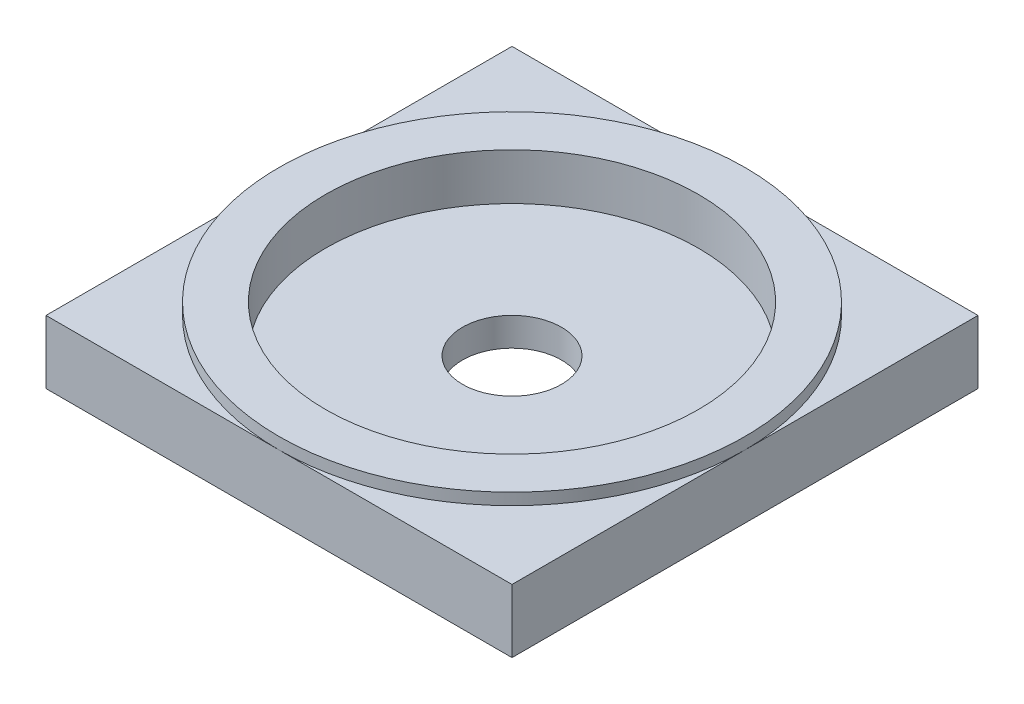
from build123d import *

# Parameters (mm, degrees)
SKETCH2_W           = 63.5
SKETCH2_H           = 63.5
BOSS_EXTRUDE1_DEPTH = 8.636
SKETCH3_R           = 31.75
BOSS_EXTRUDE2_DEPTH = 1.5875
SKETCH4_R           = 25.4
CUT_EXTRUDE1_DEPTH  = 6.35
SKETCH5_R           = 6.74624
CUT_EXTRUDE3_DEPTH  = 46.348070521


with BuildPart() as part:
    # Sketch2 → Boss-Extrude1 (new body)
    with BuildSketch(Plane(origin=(0, 0, 0), x_dir=(1, 0, 0), z_dir=(0, 1, 0))):
        Rectangle(SKETCH2_W, SKETCH2_H)
    extrude(amount=-BOSS_EXTRUDE1_DEPTH)

    # Sketch3 → Boss-Extrude2 (add)
    with BuildSketch(Plane(origin=(0, 0, 0), x_dir=(1, 0, 0), z_dir=(0, 1, 0))):
        Circle(SKETCH3_R)
    extrude(amount=BOSS_EXTRUDE2_DEPTH)

    # Sketch4 → Cut-Extrude1 (cut)
    with BuildSketch(Plane(origin=(0, 1.5875, 0), x_dir=(1, 0, 0), z_dir=(0, 1, 0))):
        Circle(SKETCH4_R)
    extrude(amount=-CUT_EXTRUDE1_DEPTH, mode=Mode.SUBTRACT)

    # Sketch5 → Cut-Extrude3 (cut, through all)
    with BuildSketch(Plane(origin=(0, -4.7625, 0), x_dir=(1, 0, 0), z_dir=(0, 1, 0))):
        Circle(SKETCH5_R)
    extrude(amount=-CUT_EXTRUDE3_DEPTH, mode=Mode.SUBTRACT)


solid = part.part
